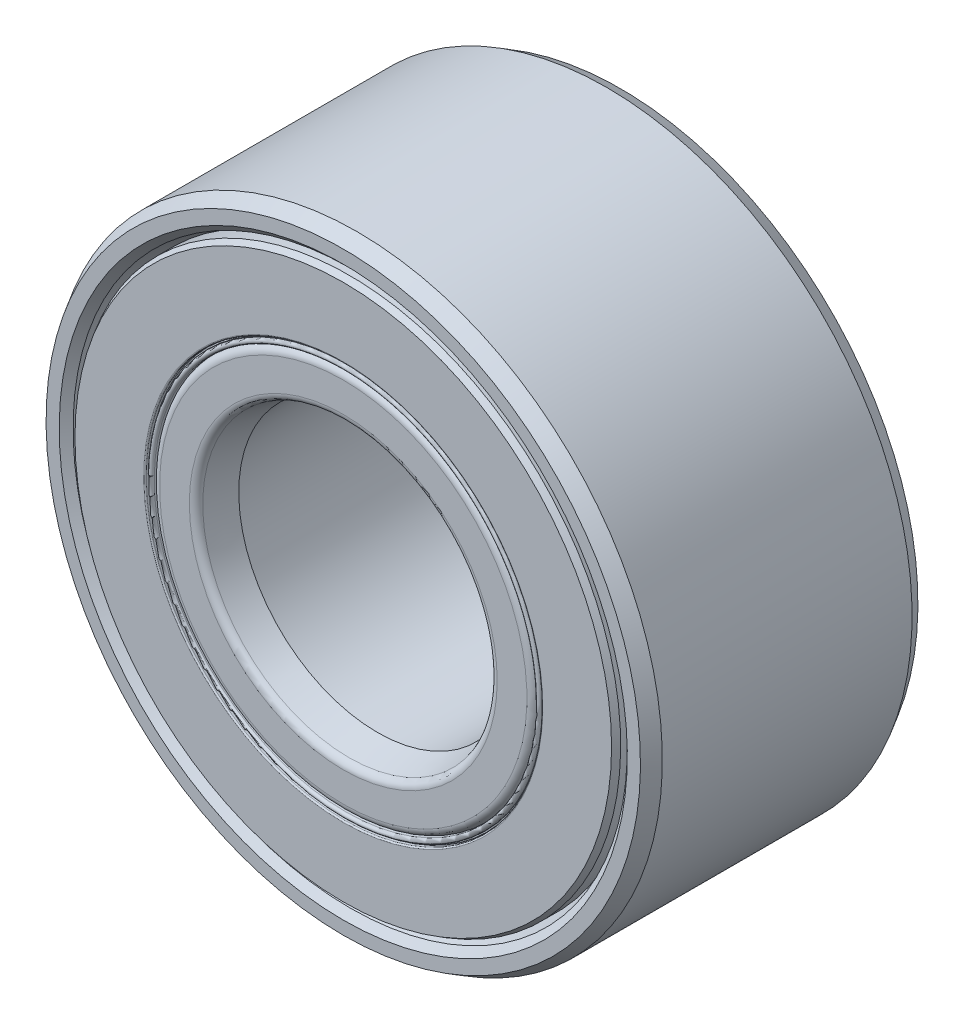
from build123d import *

# Parameters (mm, degrees)
CIRPATTERN1_COUNT = 9


with BuildPart() as part:
    # Sketch3 → Revolve1 (revolve)
    with BuildSketch(Plane(origin=(0, 0, 0), x_dir=(0, 0, -1), z_dir=(1, 0, 0))):
        with BuildLine():
            Line((-2.103734106, 4.895), (-2.375, 4.993732711))
            Line((-2.375, 4.993732711), (-2.5, 5.118732711))
            Line((-2.5, 5.118732711), (-2.5, 5.355662433))
            Line((-2.5, 5.355662433), (-2.25, 5.5))
            Line((-2.25, 5.5), (2.25, 5.5))
            Line((2.25, 5.5), (2.5, 5.355662433))
            Line((2.5, 5.355662433), (2.5, 5.118732711))
            Line((2.5, 5.118732711), (2.375, 4.993732711))
            Line((2.375, 4.993732711), (2.103734106, 4.895))
            Line((2.103734106, 4.895), (0.863030835, 4.895))
            ThreePointArc((0.863030835, 4.895), (0, 5.298333333), (-0.863030835, 4.895))
            Line((-0.863030835, 4.895), (-2.103734106, 4.895))
        make_face()
    revolve(axis=Axis((0, 0, 2.5), (0, 0, -1)))


with BuildPart() as body_2:
    # Sketch4 → Revolve2 (revolve)
    with BuildSketch(Plane(origin=(0, 0, 0), x_dir=(0, 0, -1), z_dir=(1, 0, 0))):
        with BuildLine():
            Line((-1.883210294, 2.5), (-2.394812259, 2.637083333))
            ThreePointArc((-2.394812259, 2.637083333), (-2.47067289, 2.687771787), (-2.5, 2.774166667))
            Line((-2.5, 2.774166667), (-2.5, 3.309747557))
            ThreePointArc((-2.5, 3.309747557), (-2.458432855, 3.410099522), (-2.35808089, 3.451666667))
            Line((-2.35808089, 3.451666667), (-0.863030835, 3.451666667))
            ThreePointArc((-0.863030835, 3.451666667), (0, 3.048333333), (0.863030835, 3.451666667))
            Line((0.863030835, 3.451666667), (2.35808089, 3.451666667))
            ThreePointArc((2.35808089, 3.451666667), (2.458432855, 3.410099522), (2.5, 3.309747557))
            Line((2.5, 3.309747557), (2.5, 2.774166667))
            ThreePointArc((2.5, 2.774166667), (2.47067289, 2.687771787), (2.394812259, 2.637083333))
            Line((2.394812259, 2.637083333), (1.883210294, 2.5))
            Line((1.883210294, 2.5), (-1.883210294, 2.5))
        make_face()
    revolve(axis=Axis((0, 0, 2.5), (0, 0, -1)))


with BuildPart() as body_3:
    # Sketch5 → Revolve3 (revolve)
    with BuildSketch(Plane(origin=(0, 0, 0), x_dir=(0, 0, -1), z_dir=(1, 0, 0))):
        with BuildLine():
            Line((-1.125, 4.173333333), (1.125, 4.173333333))
            ThreePointArc((1.125, 4.173333333), (0, 5.298333333), (-1.125, 4.173333333))
        make_face()
    revolve(axis=Axis((0, 4.173333333, 1.125), (0, 0, -1)))


with BuildPart() as cirpattern1_1:
    # CirPattern1: pattern copy
    add(body_3.part.rotate(Axis((0, 0, 2.5), (0, 0, -1)), 1 * 360 / CIRPATTERN1_COUNT))


with BuildPart() as cirpattern1_2:
    # CirPattern1: pattern copy
    add(body_3.part.rotate(Axis((0, 0, 2.5), (0, 0, -1)), 2 * 360 / CIRPATTERN1_COUNT))


with BuildPart() as cirpattern1_3:
    # CirPattern1: pattern copy
    add(body_3.part.rotate(Axis((0, 0, 2.5), (0, 0, -1)), 3 * 360 / CIRPATTERN1_COUNT))


with BuildPart() as cirpattern1_4:
    # CirPattern1: pattern copy
    add(body_3.part.rotate(Axis((0, 0, 2.5), (0, 0, -1)), 4 * 360 / CIRPATTERN1_COUNT))


with BuildPart() as cirpattern1_5:
    # CirPattern1: pattern copy
    add(body_3.part.rotate(Axis((0, 0, 2.5), (0, 0, -1)), 5 * 360 / CIRPATTERN1_COUNT))


with BuildPart() as cirpattern1_6:
    # CirPattern1: pattern copy
    add(body_3.part.rotate(Axis((0, 0, 2.5), (0, 0, -1)), 6 * 360 / CIRPATTERN1_COUNT))


with BuildPart() as cirpattern1_7:
    # CirPattern1: pattern copy
    add(body_3.part.rotate(Axis((0, 0, 2.5), (0, 0, -1)), 7 * 360 / CIRPATTERN1_COUNT))


with BuildPart() as cirpattern1_8:
    # CirPattern1: pattern copy
    add(body_3.part.rotate(Axis((0, 0, 2.5), (0, 0, -1)), 8 * 360 / CIRPATTERN1_COUNT))


with BuildPart() as body_12:
    # Sketch6 → Revolve4 (revolve)
    with BuildSketch(Plane(origin=(0, 0, 0), x_dir=(0, 0, -1), z_dir=(1, 0, 0))):
        with BuildLine():
            Line((-2.396076952, 4.895), (-1.125, 4.895))
            Line((-1.125, 4.895), (-1.125, 3.571666667))
            Line((-1.125, 3.571666667), (-2.476, 3.571666667))
            ThreePointArc((-2.476, 3.571666667), (-2.492970563, 3.578696104), (-2.5, 3.595666667))
            Line((-2.5, 3.595666667), (-2.5, 4.835))
            Line((-2.5, 4.835), (-2.396076952, 4.895))
        make_face()
        with BuildLine():
            Line((2.476, 3.571666667), (1.125, 3.571666667))
            Line((1.125, 3.571666667), (1.125, 4.895))
            Line((1.125, 4.895), (2.396076952, 4.895))
            Line((2.396076952, 4.895), (2.5, 4.835))
            Line((2.5, 4.835), (2.5, 3.595666667))
            ThreePointArc((2.5, 3.595666667), (2.492970563, 3.578696104), (2.476, 3.571666667))
        make_face()
    revolve(axis=Axis((0, 0, 2.5), (0, 0, -1)))


with BuildPart() as body_13:
    # Sketch7 → Revolve5 (revolve)
    with BuildSketch(Plane(origin=(0, 0, 0), x_dir=(0, 0, -1), z_dir=(1, 0, 0))):
        with BuildLine():
            Line((-1.125, 3.571666667), (-2.40262466, 3.571666667))
            Line((-2.40262466, 3.571666667), (-2.432168892, 3.566457221))
            ThreePointArc((-2.432168892, 3.566457221), (-2.442442625, 3.553068232), (-2.43, 3.541666667))
            Line((-2.43, 3.541666667), (-2.455, 3.541666667))
            ThreePointArc((-2.455, 3.541666667), (-2.5, 3.496666667), (-2.455, 3.451666667))
            Line((-2.455, 3.451666667), (-1.125, 3.451666667))
            Line((-1.125, 3.451666667), (-1.125, 3.571666667))
        make_face()
    revolve(axis=Axis((0, 0, 2.5), (0, 0, -1)))


solid = Compound([part.part, body_2.part, body_3.part, cirpattern1_1.part, cirpattern1_2.part, cirpattern1_3.part, cirpattern1_4.part, cirpattern1_5.part, cirpattern1_6.part, cirpattern1_7.part, cirpattern1_8.part, body_12.part, body_13.part])
